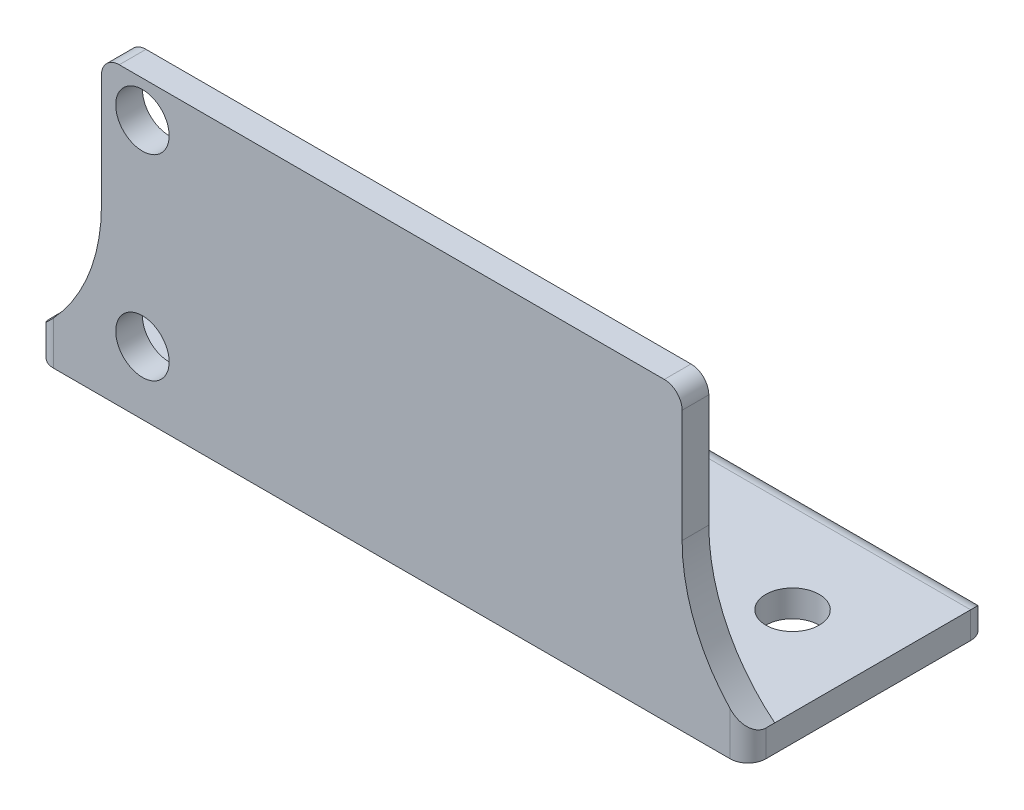
from build123d import *

# Parameters (mm, degrees)
SKETCH1_W           = 32.6
SKETCH1_H           = 15.1
SKETCH1_R           = 1.5
BOSS_EXTRUDE1_DEPTH = 1.5
SKETCH2_W           = 40
SKETCH2_H           = 13.5
SKETCH2_R           = 1.5
BOSS_EXTRUDE2_DEPTH = 1.5
FILLET1_R           = 10
FILLET2_R           = 1


with BuildPart() as part:
    # Sketch1 → Boss-Extrude1 (new body)
    with BuildSketch(Plane.XY):
        Rectangle(SKETCH1_W, SKETCH1_H)
        with Locations((-14, 5.5)):
            Circle(SKETCH1_R, mode=Mode.SUBTRACT)
        with Locations((-14, -5.5)):
            Circle(SKETCH1_R, mode=Mode.SUBTRACT)
    extrude(amount=BOSS_EXTRUDE1_DEPTH)

    # Sketch2 → Boss-Extrude2 (add)
    with BuildSketch(Plane.XZ.offset(7.55)):
        with Locations((0, -5.25)):
            Rectangle(SKETCH2_W, SKETCH2_H)
        with Locations(Location((-15, -6, 0), (0, 0, 270))):
            Circle(SKETCH2_R, mode=Mode.SUBTRACT)
        with Locations(Location((15, -6, 0), (0, 0, 270))):
            Circle(SKETCH2_R, mode=Mode.SUBTRACT)
    extrude(amount=BOSS_EXTRUDE2_DEPTH)

    # Fillet1
    # the kernel refuses this fillet: 10 mm, written as the material it adds along each edge
    with BuildSketch(Plane(origin=(16.3, -7.55, 0), x_dir=(1, 0, 0), z_dir=(0, 0, 1))) as fillet1_piece_1:
        with BuildLine():
            CenterArc((10, 7.765951326), FILLET1_R, 180, 50.949877464)
            Line((0, 7.765951326), (-0.2, 7.765951326))
            Line((-0.2, 7.765951326), (-0.2, 0))
            Line((-0.2, 0), (0, -0.2))
            ThreePointArc((0, -0.2), (1.85, -0.2), (3.574, -0.155319027))
            Line((3.574, -0.155319027), (3.7, 0))
        make_face()
    extrude(amount=1.5)
    with BuildSketch(Plane(origin=(-16.3, -7.55, 0), x_dir=(-1, 0, 0), z_dir=(0, 0, 1))) as fillet1_piece_2:
        with BuildLine():
            CenterArc((10, -7.765951326), FILLET1_R, 129.050122536, 50.949877464)
            Line((0, -7.765951326), (-0.2, -7.765951326))
            Line((-0.2, -7.765951326), (-0.2, 0))
            Line((-0.2, 0), (0, 0.2))
            ThreePointArc((0, 0.2), (1.85, 0.2), (3.574, 0.155319027))
            Line((3.574, 0.155319027), (3.7, 0))
        make_face()
    extrude(amount=1.5)

    # Fillet2
    fillet2_edges = [part.edges().sort_by_distance(p)[0] for p in [
        (-20, -8.3, 1.5),
        (0, -7.55, -12),
        (-20, -8.3, -12),
        (20, -8.3, -12),
        (20, -8.3, 1.5),
        (-16.3, 7.55, 0.75),
        (16.3, 7.55, 0.75),
    ]]
    fillet(fillet2_edges, radius=FILLET2_R)


solid = part.part
